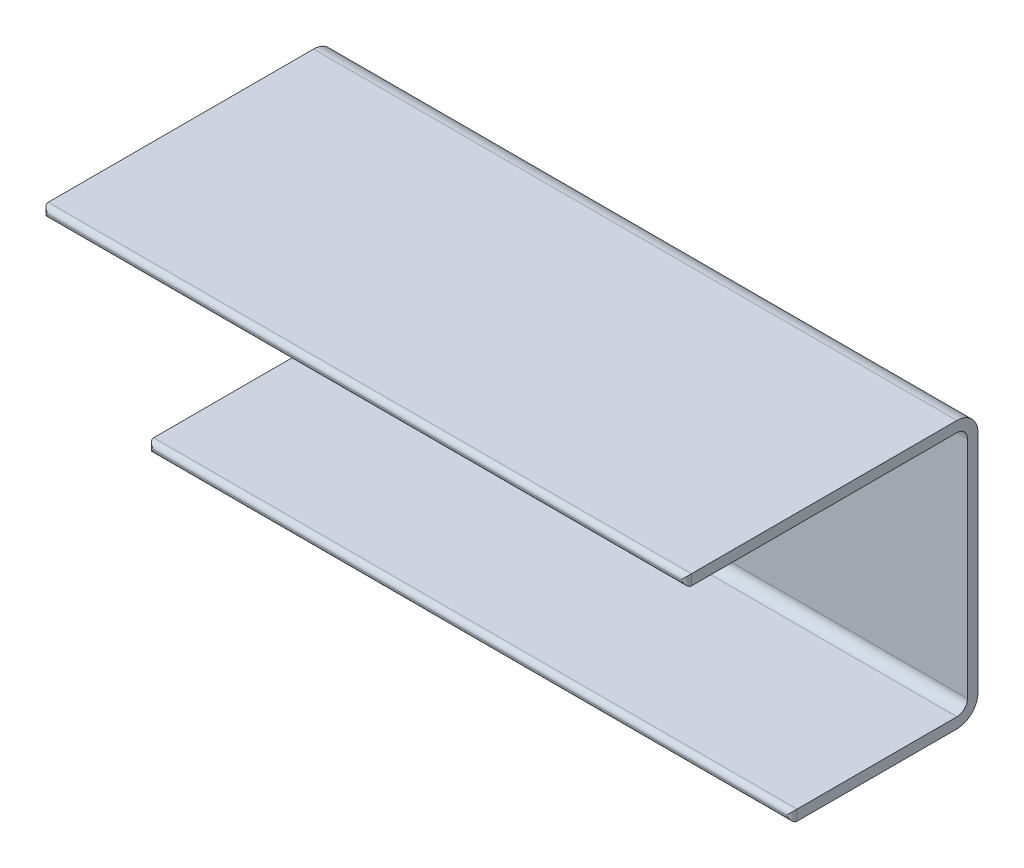
from build123d import *

# Parameters (mm, degrees)
SKETCH1_W           = 183
SKETCH1_H           = 50
BOSS_EXTRUDE1_DEPTH = 3
SKETCH2_W           = 183
SKETCH2_H           = 76
BOSS_EXTRUDE2_DEPTH = 3
SKETCH3_W           = 183
SKETCH3_H           = 3
BOSS_EXTRUDE3_DEPTH = 80
FILLET2_R           = 1.5
CUT_EXTRUDE1_REACH  = 145.347
FILLET3_R           = 3
FILLET4_R           = 6


with BuildPart() as part:
    # Sketch1 → Boss-Extrude1 (new body)
    with BuildSketch(Plane(origin=(0, 0, 0), x_dir=(1, 0, 0), z_dir=(0, 1, 0))):
        Rectangle(SKETCH1_W, SKETCH1_H)
    extrude(amount=BOSS_EXTRUDE1_DEPTH)

    # Sketch2 → Boss-Extrude2 (add)
    with BuildSketch(Plane(origin=(0, 0, -25), x_dir=(-1, 0, 0), z_dir=(0, 0, -1))):
        with Locations((0, 38)):
            Rectangle(SKETCH2_W, SKETCH2_H)
    extrude(amount=BOSS_EXTRUDE2_DEPTH)

    # Sketch3 → Boss-Extrude3 (add)
    with BuildSketch(Plane.XY.offset(-25)):
        with Locations((0, 74.5)):
            Rectangle(SKETCH3_W, SKETCH3_H)
    extrude(amount=BOSS_EXTRUDE3_DEPTH)

    # Fillet2
    fillet2_edges = [part.edges().sort_by_distance(p)[0] for p in [
        (0, 3, 25),
        (-91.5, 74.5, 55),
        (0, 73, 55),
        (91.5, 74.5, 55),
        (0, 76, 55),
        (0, 0, 25),
        (91.5, 1.5, 25),
        (-91.5, 1.5, 25),
    ]]
    fillet(fillet2_edges, radius=FILLET2_R - 0.0001)  # a hair under: the kernel refuses the full size

    # Sketch4 → Cut-Extrude1 (cut, up to next)
    with BuildSketch(Plane.XY.offset(-25), mode=Mode.PRIVATE) as cut_extrude1_sk1:
        with BuildLine():
            Line((-14, 56.5), (14, 56.5))
            ThreePointArc((14, 56.5), (25, 45.5), (14, 34.5))
            Line((14, 34.5), (-14, 34.5))
            ThreePointArc((-14, 34.5), (-25, 45.5), (-14, 56.5))
        make_face()
    cut_extrude1_tool1 = extrude(cut_extrude1_sk1.sketch, amount=-CUT_EXTRUDE1_REACH, mode=Mode.PRIVATE) & part.part
    add(cut_extrude1_tool1.solids().sort_by_distance((0, 45.5, -25))[0], mode=Mode.SUBTRACT)

    # Fillet3
    fillet3_edges = [part.edges().sort_by_distance(p)[0] for p in [
        (0, 73, -25),
        (0, 3, -25),
    ]]
    fillet(fillet3_edges, radius=FILLET3_R)

    # Fillet4
    fillet4_edges = [part.edges().sort_by_distance(p)[0] for p in [
        (0, 0, -28),
        (0, 76, -28),
    ]]
    fillet(fillet4_edges, radius=FILLET4_R)


solid = part.part
